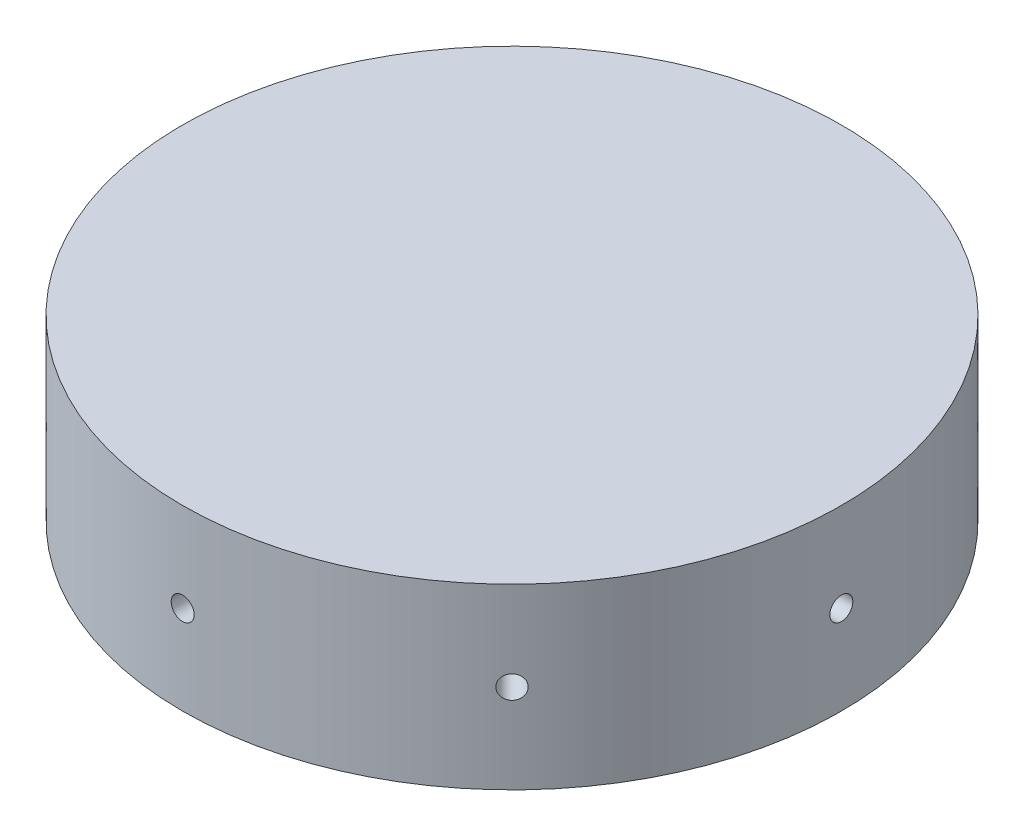
from build123d import *

# Parameters (mm, degrees)
SKETCH1_R                = 46.99
BULKHEAD_EXTRUSION_DEPTH = 25.4
SKETCH2_R                = 1.6383
SCREW_HOLE_DEPTH         = 12.7
CIRPATTERN1_COUNT        = 8


with BuildPart() as part:
    # Sketch1 → Bulkhead Extrusion (new body)
    with BuildSketch(Plane(origin=(0, 0, 0), x_dir=(1, 0, 0), z_dir=(0, 1, 0))):
        Circle(SKETCH1_R)
    extrude(amount=BULKHEAD_EXTRUSION_DEPTH)

    # Sketch2 → Screw Hole (cut)
    with BuildSketch(Plane.XY.offset(46.99)):
        with Locations((0, 12.7)):
            Circle(SKETCH2_R)
    screw_hole = extrude(amount=-SCREW_HOLE_DEPTH, mode=Mode.SUBTRACT)

    # CirPattern1: Screw Hole ×8 about axis
    cirpattern1_axis = Axis((0, 25.4, 0), (0, -1, 0))
    for i in range(1, CIRPATTERN1_COUNT):
        add(screw_hole.rotate(cirpattern1_axis, i * 360 / CIRPATTERN1_COUNT), mode=Mode.SUBTRACT)


solid = part.part
